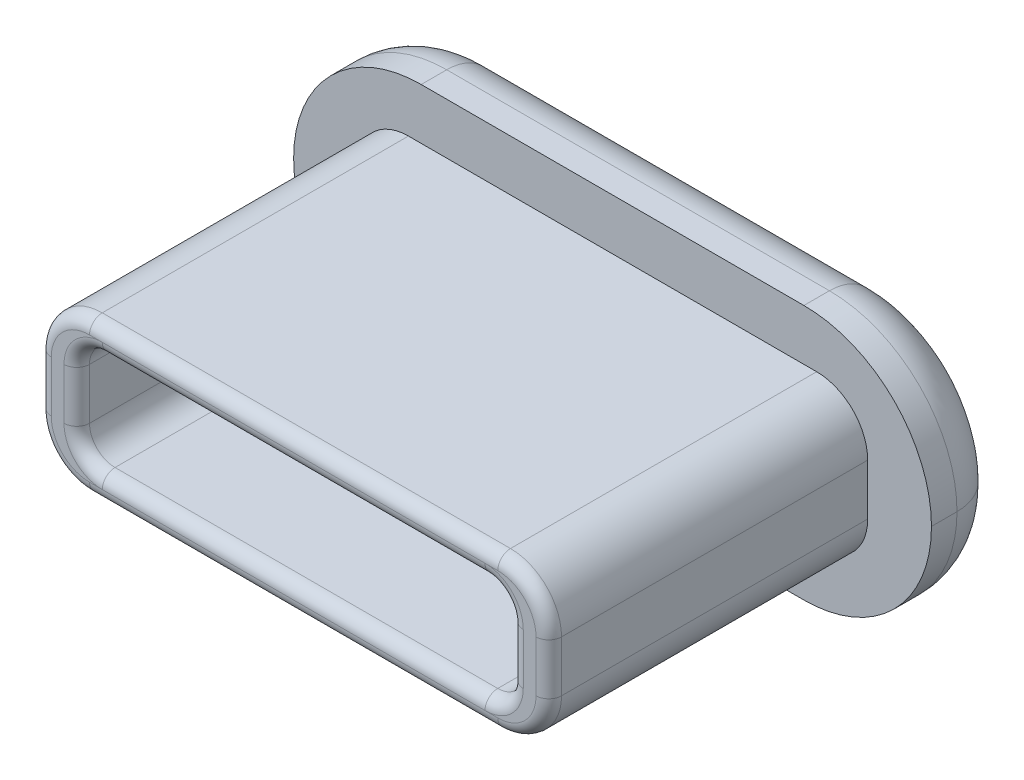
from build123d import *

# Parameters (mm, degrees)
SKETCH_1_W      = 10
SKETCH_1_H      = 4
EXTRUDE_1_DEPTH = 1.2
SKETCH_2_W      = 8
SKETCH_2_H      = 2.4
SKETCH_2_W_2    = 6.8
SKETCH_2_H_2    = 1.6
EXTRUDE_2_DEPTH = 5
FILLET_1_R      = 2
FILLET_2_R      = 0.8
FILLET_3_R      = 0.8
FILLET_4_R      = 0.4
FILLET_5_R      = 0.2


with BuildPart() as part:
    # Эскиз1 → Бобышка-Вытянуть1 (new body)
    with BuildSketch(Plane.XY):
        Rectangle(SKETCH_1_W, SKETCH_1_H)
    extrude(amount=EXTRUDE_1_DEPTH)

    # Эскиз2 → Бобышка-Вытянуть2 (add)
    with BuildSketch(Plane.XY.offset(1.2)):
        Rectangle(SKETCH_2_W, SKETCH_2_H)
        Rectangle(SKETCH_2_W_2, SKETCH_2_H_2, mode=Mode.SUBTRACT)
    extrude(amount=EXTRUDE_2_DEPTH)

    # Скругление1
    fillet_1_edges = [part.edges().sort_by_distance(p)[0] for p in [
        (5, 2, 0.6),
        (5, -2, 0.6),
        (-5, -2, 0.6),
        (-5, 2, 0.6),
    ]]
    fillet(fillet_1_edges, radius=FILLET_1_R - 0.0001)  # a hair under: the kernel refuses the full size

    # Скругление2
    fillet_2_edges = [part.edges().sort_by_distance(p)[0] for p in [
        (0, 2, 0),
        (0, -2, 0),
        (-4.414242852, 1.414242852, 0),
        (-4.414242852, -1.414242852, 0),
        (4.414242852, -1.414242852, 0),
        (4.414242852, 1.414242852, 0),
    ]]
    fillet(fillet_2_edges, radius=FILLET_2_R)

    # Скругление3
    fillet_3_edges = [part.edges().sort_by_distance(p)[0] for p in [
        (4, -1.2, 3.7),
        (4, 1.2, 3.7),
        (-4, 1.2, 3.7),
        (-4, -1.2, 3.7),
    ]]
    fillet(fillet_3_edges, radius=FILLET_3_R)

    # Скругление4
    fillet_4_edges = [part.edges().sort_by_distance(p)[0] for p in [
        (3.4, 0.8, 3.7),
        (-3.4, 0.8, 3.7),
        (-3.4, -0.8, 3.7),
        (3.4, -0.8, 3.7),
    ]]
    fillet(fillet_4_edges, radius=FILLET_4_R)

    # Скругление5
    fillet_5_edges = [part.edges().sort_by_distance(p)[0] for p in [
        (-3.4, 0, 6.2),
        (0, -0.8, 6.2),
        (3.4, 0, 6.2),
        (0, 0.8, 6.2),
        (-3.282842712, -0.682842712, 6.2),
        (3.282842712, -0.682842712, 6.2),
        (3.282842712, 0.682842712, 6.2),
        (-3.282842712, 0.682842712, 6.2),
        (0, -1.2, 6.2),
        (-4, 0, 6.2),
        (4, 0, 6.2),
        (0, 1.2, 6.2),
        (-3.765685425, 0.965685425, 6.2),
        (3.765685425, 0.965685425, 6.2),
        (3.765685425, -0.965685425, 6.2),
        (-3.765685425, -0.965685425, 6.2),
    ]]
    fillet(fillet_5_edges, radius=FILLET_5_R - 0.0001)  # a hair under: the kernel refuses the full size


solid = part.part
